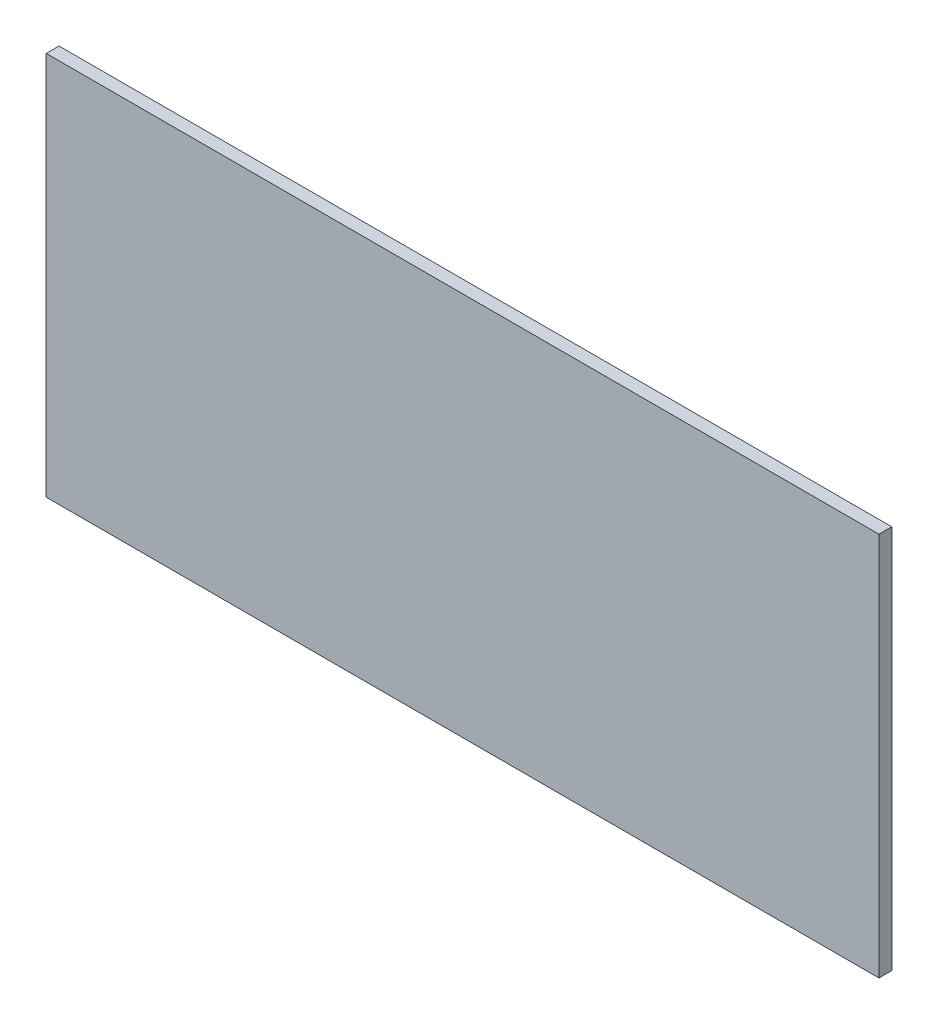
from build123d import *

# Parameters (mm, degrees)
SKETCH1_W           = 65
SKETCH1_H           = 30
BOSS_EXTRUDE1_DEPTH = 1
BOSS_EXTRUDE2_DEPTH = 1


with BuildPart() as part:
    # Sketch1 → Boss-Extrude1 (new body)
    with BuildSketch(Plane.XY):
        with Locations((125.94074046, -0.055)):
            Rectangle(SKETCH1_W, SKETCH1_H)
    extrude(amount=-BOSS_EXTRUDE1_DEPTH)


with BuildPart() as body_2:
    # Sketch2 → Boss-Extrude2 (new body)
    with BuildSketch(Plane(origin=(0, 0, -1), x_dir=(-1, 0, 0), z_dir=(0, 0, -1))):
        with BuildLine():
            Line((-148.44074046, 9.445), (-103.44074046, 9.445))
            ThreePointArc((-103.44074046, 9.445), (-101.672973507, 8.712766953), (-100.94074046, 6.945))
            Line((-100.94074046, 6.945), (-100.94074046, -7.055))
            ThreePointArc((-100.94074046, -7.055), (-101.672973507, -8.822766953), (-103.44074046, -9.555))
            Line((-103.44074046, -9.555), (-148.44074046, -9.555))
            ThreePointArc((-148.44074046, -9.555), (-150.208507413, -8.822766953), (-150.94074046, -7.055))
            Line((-150.94074046, -7.055), (-150.94074046, 6.945))
            ThreePointArc((-150.94074046, 6.945), (-150.208507413, 8.712766953), (-148.44074046, 9.445))
        make_face()
    extrude(amount=BOSS_EXTRUDE2_DEPTH)


solid = Compound([part.part, body_2.part])
